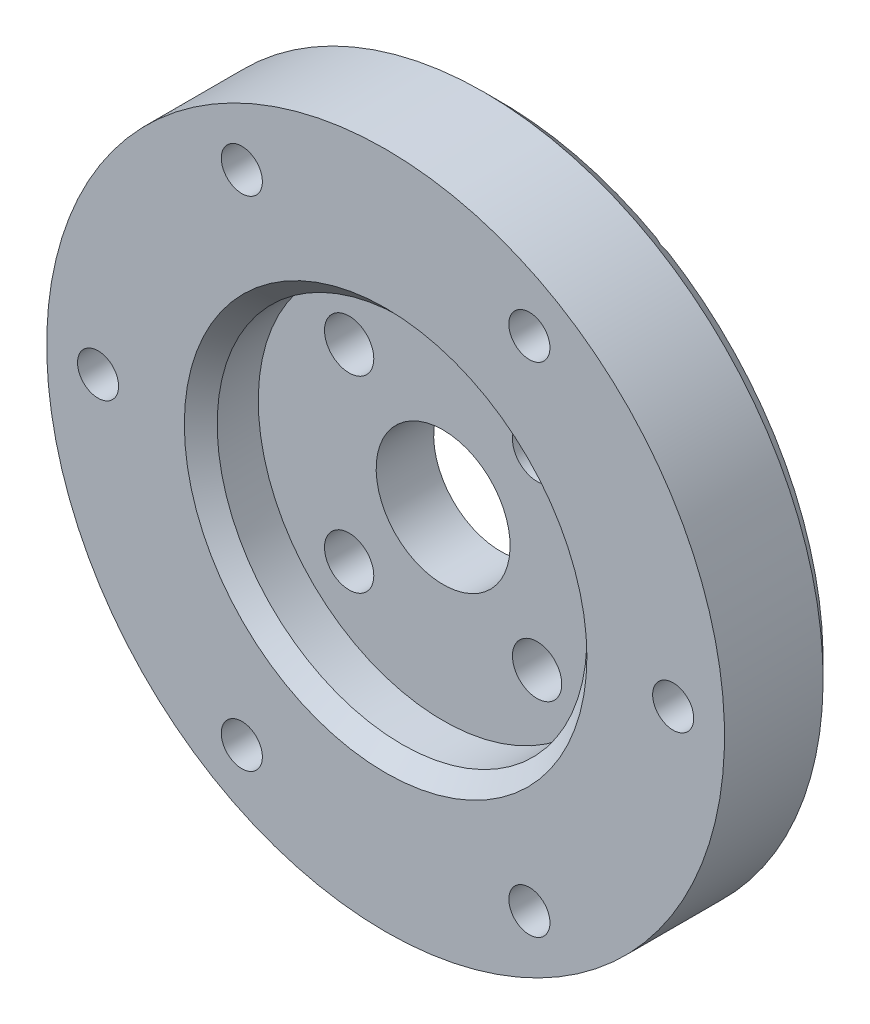
from build123d import *

# Parameters (mm, degrees)
SKETCH_2_R          = 2.5
SKETCH_2_R_2        = 3
CUT_EXTRUDE_1_DEPTH = 60.99270789
CUT_EXTRUDE_2_DEPTH = 8
CHAMFER_1_SIZE      = 2


with BuildPart() as part:
    # 草图1 → 旋转1 (revolve)
    with BuildSketch(Plane(origin=(0, 0, 0), x_dir=(0, 0, -1), z_dir=(1, 0, 0))):
        Polygon((0, 41.25), (0, 22.5), (7, 22.5), (7, 8.15), (14, 8.15), (14, 41.25), align=None)
    revolve(axis=Axis((0, 0, -14), (0, 0, 1)))

    # 草图2 → 切除-拉伸1 (cut, through all)
    with BuildSketch(Plane.XY):
        with Locations((-17.5, 30.310889132)):
            Circle(SKETCH_2_R)
        with Locations((17.5, 30.310889132)):
            Circle(SKETCH_2_R)
        with Locations((35, 0)):
            Circle(SKETCH_2_R)
        with Locations((17.5, -30.310889132)):
            Circle(SKETCH_2_R)
        with Locations((-17.5, -30.310889132)):
            Circle(SKETCH_2_R)
        with Locations((-35, 0)):
            Circle(SKETCH_2_R)
        with Locations((-11.437452186, 11.437452186)):
            Circle(SKETCH_2_R_2)
        with Locations((11.437452186, 11.437452186)):
            Circle(SKETCH_2_R_2)
        with Locations((11.437452186, -11.437452186)):
            Circle(SKETCH_2_R_2)
        with Locations((-11.437452186, -11.437452186)):
            Circle(SKETCH_2_R_2)
    extrude(amount=-CUT_EXTRUDE_1_DEPTH, mode=Mode.SUBTRACT)

    # 草图3 → 切除-拉伸2 (cut)
    with BuildSketch(Plane(origin=(0, 0, -14), x_dir=(-1, 0, 0), z_dir=(0, 0, -1))):
        Polygon((-12.82346282, 30.310889132), (-15.16173141, 34.360889132), (-19.83826859, 34.360889132), (-22.17653718, 30.310889132), (-19.83826859, 26.260889132), (-15.16173141, 26.260889132), align=None)
        Polygon((19.83826859, 26.260889132), (22.17653718, 30.310889132), (19.83826859, 34.360889132), (15.16173141, 34.360889132), (12.82346282, 30.310889132), (15.16173141, 26.260889132), align=None)
        Polygon((32.66173141, -4.05), (37.33826859, -4.05), (39.67653718, 0), (37.33826859, 4.05), (32.66173141, 4.05), (30.32346282, 0), align=None)
        Polygon((19.83826859, -26.260889132), (15.16173141, -26.260889132), (12.82346282, -30.310889132), (15.16173141, -34.360889132), (19.83826859, -34.360889132), (22.17653718, -30.310889132), align=None)
        Polygon((-15.16173141, -26.260889132), (-19.83826859, -26.260889132), (-22.17653718, -30.310889132), (-19.83826859, -34.360889132), (-15.16173141, -34.360889132), (-12.82346282, -30.310889132), align=None)
        Polygon((-32.66173141, 4.05), (-37.33826859, 4.05), (-39.67653718, 0), (-37.33826859, -4.05), (-32.66173141, -4.05), (-30.32346282, 0), align=None)
    extrude(amount=-CUT_EXTRUDE_2_DEPTH, mode=Mode.SUBTRACT)

    # 倒角1
    # the kernel refuses this chamfer: 2 mm, written as the material it takes off along each edge
    with BuildSketch(Plane(origin=(0, 0, -14), x_dir=(0, 1, 0), z_dir=(1, 0, 0))) as chamfer_1_piece_1:
        Polygon((41.25, CHAMFER_1_SIZE), (41.25 - CHAMFER_1_SIZE, 0), (41.25, 0), align=None)
    revolve(axis=Axis((0, 0, -14), (0, 0, 1)), mode=Mode.SUBTRACT)
    with BuildSketch(Plane(origin=(0, 0, 0), x_dir=(0, 1, 0), z_dir=(1, 0, 0))) as chamfer_1_piece_2:
        Polygon((22.5 + CHAMFER_1_SIZE, 0), (22.5, -CHAMFER_1_SIZE), (22.5, 0), align=None)
    revolve(axis=Axis((0, 0, 0), (0, 0, 1)), mode=Mode.SUBTRACT)


solid = part.part
